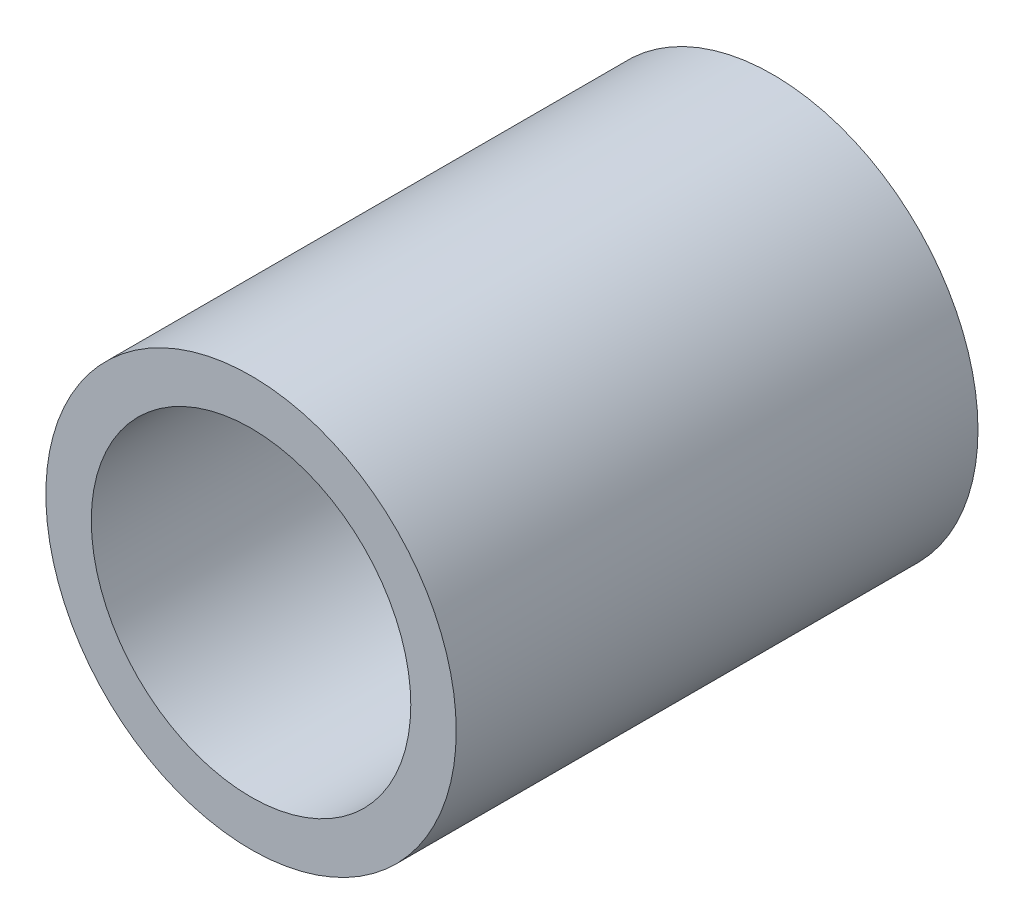
from build123d import *

# Parameters (mm, degrees)
SKETCH1_R           = 3.5
SKETCH1_R_2         = 2.725
BOSS_EXTRUDE1_DEPTH = 8.9


with BuildPart() as part:
    # Sketch1 → Boss-Extrude1 (new body)
    with BuildSketch(Plane.XY):
        Circle(SKETCH1_R)
        Circle(SKETCH1_R_2, mode=Mode.SUBTRACT)
    extrude(amount=BOSS_EXTRUDE1_DEPTH)


solid = part.part
